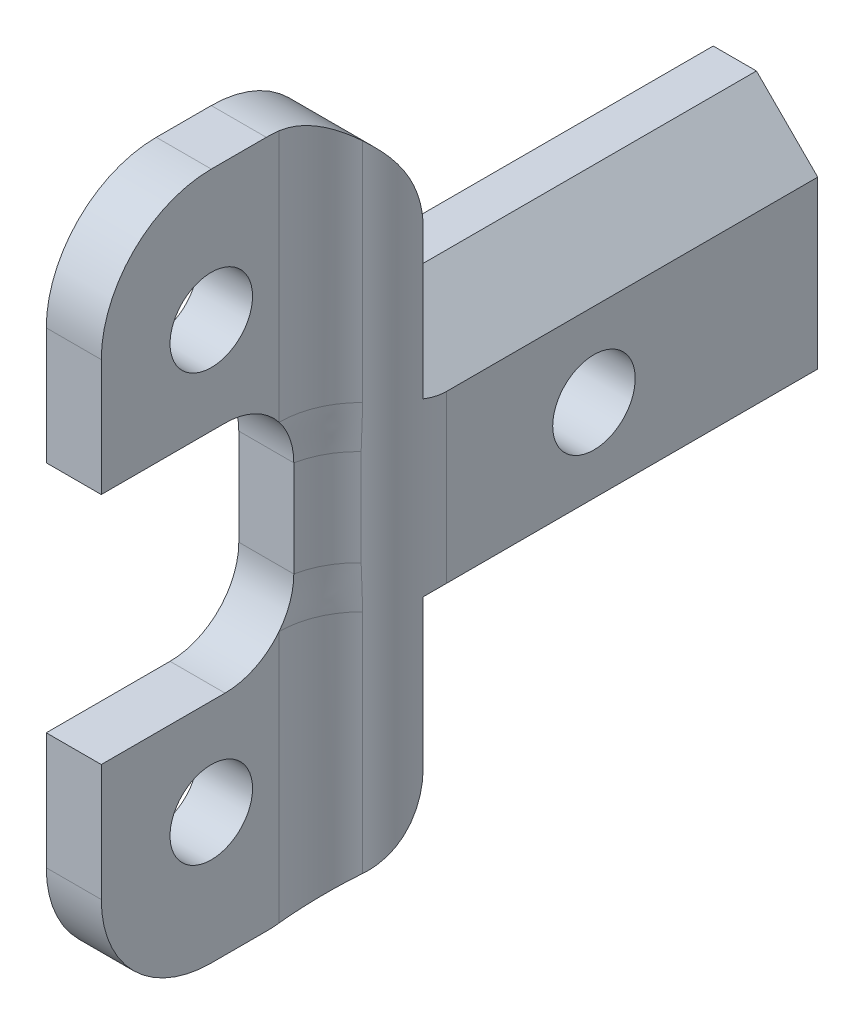
from build123d import *

# Parameters (mm, degrees)
BOSS_EXTRUDE1_DEPTH      = 0.25
BOSS_EXTRUDE1_DEPTH_BACK = 14
SKETCH2_R                = 1.5
CUT_EXTRUDE1_DEPTH       = 14
SKETCH3_W                = 3.8
SKETCH3_H                = 25
BOSS_EXTRUDE2_DEPTH      = 10
CUT_EXTRUDE2_DEPTH       = 55.467329657
CUT_EXTRUDE2_DEPTH_BACK  = 55.467329657
SKETCH4_R                = 1.5
SKETCH4_W                = 7
SKETCH4_H                = 8.5
FILLET1_R                = 4
FILLET2_R                = 2.5
SKETCH5_W                = 8
SKETCH5_H                = 25
CUT_EXTRUDE3_DEPTH       = 1.8
FILLET3_R                = 3
FILLET4_R                = 3


with BuildPart() as part:
    # Sketch1 → Boss-Extrude1 (new, two sides: drawn at the far end of the back side and taken through both)
    with BuildSketch(Plane.XY.offset(-BOSS_EXTRUDE1_DEPTH_BACK)):
        Polygon((-23.42202285, 43.125), (-23.42202285, 45.25), (-21.850576241, 45.25), (-19.62202285, 43.021446609), (-19.62202285, 36.978553391), (-21.850576241, 34.75), (-23.42202285, 34.75), align=None)
    extrude(amount=BOSS_EXTRUDE1_DEPTH + BOSS_EXTRUDE1_DEPTH_BACK)

    # Sketch2 → Cut-Extrude1 (cut)
    with BuildSketch(Plane.ZY.offset(23.42202285)):
        with Locations((-5.863626805, 40)):
            Circle(SKETCH2_R)
    extrude(amount=-CUT_EXTRUDE1_DEPTH, mode=Mode.SUBTRACT)

    # Sketch3 → Boss-Extrude2 (add)
    with BuildSketch(Plane.XY.offset(0.25)):
        with Locations((-21.52202285, 40)):
            Rectangle(SKETCH3_W, SKETCH3_H)
    extrude(amount=BOSS_EXTRUDE2_DEPTH)

    # Sketch4 → Cut-Extrude2 (cut, two sides: drawn at the far end of the back side and taken through both)
    with BuildSketch(Plane.ZY.offset(23.42202285).offset(-CUT_EXTRUDE2_DEPTH_BACK)):
        with Locations((6.25, 47.75)):
            Circle(SKETCH4_R)
        with Locations((6.25, 32.25)):
            Circle(SKETCH4_R)
        with Locations((6.75, 40)):
            Rectangle(SKETCH4_W, SKETCH4_H)
    extrude(amount=CUT_EXTRUDE2_DEPTH + CUT_EXTRUDE2_DEPTH_BACK, mode=Mode.SUBTRACT)

    # Fillet1
    fillet1_edges = [part.edges().sort_by_distance(p)[0] for p in [
        (-21.52202285, 27.5, 0.25),
        (-21.52202285, 52.5, 0.25),
        (-21.52202285, 27.5, 10.25),
        (-21.52202285, 52.5, 10.25),
    ]]
    fillet(fillet1_edges, radius=FILLET1_R)

    # Fillet2
    fillet2_edges = [part.edges().sort_by_distance(p)[0] for p in [
        (-21.52202285, 35.75, 3.25),
        (-21.52202285, 44.25, 3.25),
    ]]
    fillet(fillet2_edges, radius=FILLET2_R)

    # Sketch5 → Cut-Extrude3 (cut)
    with BuildSketch(Plane(origin=(-19.62202285, 0, 0), x_dir=(0, 0, -1), z_dir=(1, 0, 0))):
        with Locations((-6.25, 40)):
            Rectangle(SKETCH5_W, SKETCH5_H)
    extrude(amount=-CUT_EXTRUDE3_DEPTH, mode=Mode.SUBTRACT)

    # Fillet3
    # the kernel refuses this fillet: 3 mm, written as the material it takes off along each edge
    with BuildSketch(Plane(origin=(-19.62202285, 58.837965158, 2.25), x_dir=(-1, 0, 0), z_dir=(0, -1, 0))) as fillet3_piece_1:
        with BuildLine():
            CenterArc((3, 2.749545417), FILLET3_R, 180, 66.421821522)
            Line((0, 2.749545417), (-0.06, 2.749545417))
            Line((-0.06, 2.749545417), (-0.06, 0))
            Line((-0.06, 0), (0, -0.06))
            ThreePointArc((0, -0.06), (0.9, -0.06), (1.776, -0.054990908))
            Line((1.776, -0.054990908), (1.8, 0))
        make_face()
    extrude(amount=37.675930315, mode=Mode.SUBTRACT)

    # Fillet4
    fillet4_edges = [part.edges().sort_by_distance(p)[0] for p in [
        (-21.42202285, 40, 2.25),
    ]]
    fillet(fillet4_edges, radius=FILLET4_R)


solid = part.part
